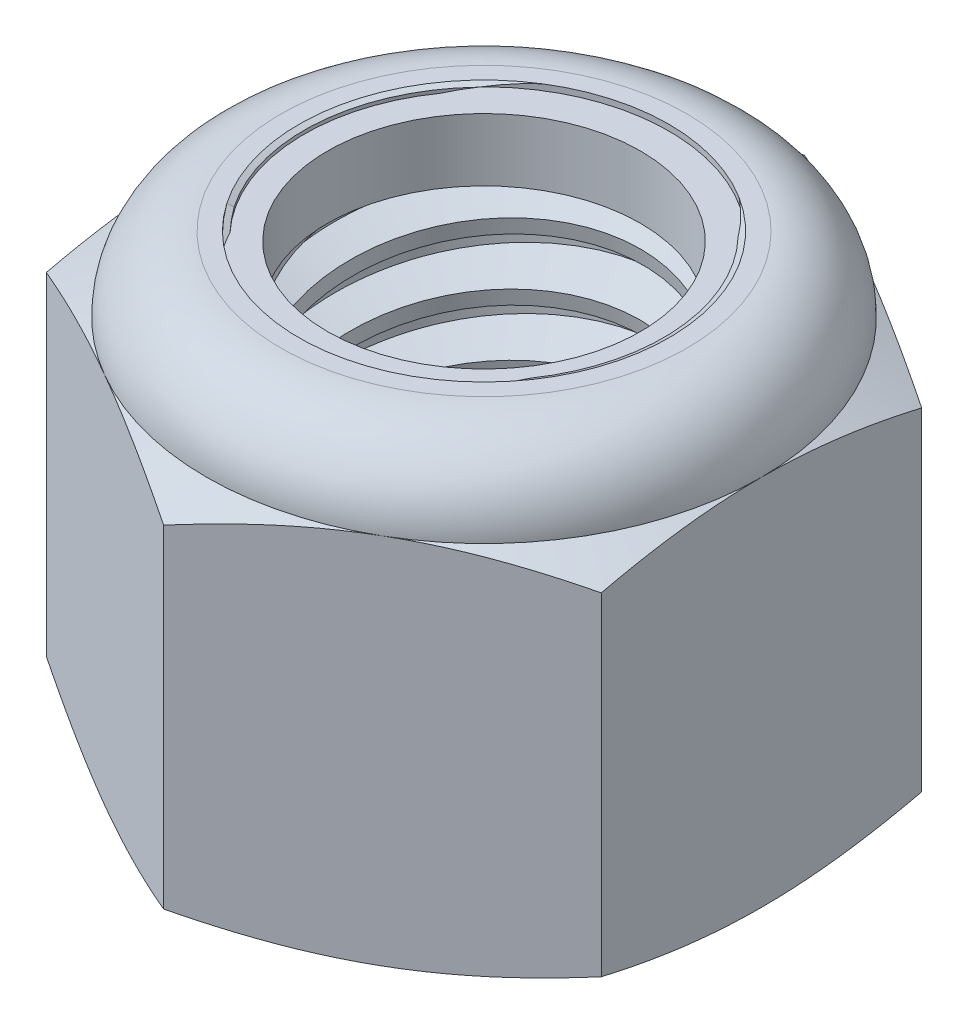
from build123d import *

# Parameters (mm, degrees)
EXTRUDE1_DEPTH       = 11.509375
SKETCH2_W            = 4.7625
SKETCH2_H            = 11.509375
LPATTERN1_COUNT      = 7
LPATTERN1_PITCH      = 1.5875
LPATTERN1_COUNT_DIR2 = 2
LPATTERN1_PITCH_DIR2 = 1.5875


with BuildPart() as part:
    # Sketch1 → Extrude1 (new body)
    with BuildSketch(Plane(origin=(0, 0, 0), x_dir=(1, 0, 0), z_dir=(0, 1, 0))):
        Polygon((0, 8.248891971), (-7.14375, 4.124445986), (-7.14375, -4.124445986), (0, -8.248891971), (7.14375, -4.124445986), (7.14375, 4.124445986), align=None)
    extrude(amount=EXTRUDE1_DEPTH)

    # Sketch4 → Cut-Revolve2 (revolve, cut)
    with BuildSketch(Plane(origin=(0, 0, 0), x_dir=(0, 0, -1), z_dir=(1, 0, 0))):
        Polygon((0, 11.509375), (4.7625, 11.509375), (4.029111805, 11.167390468), (4.029111805, 0.341984532), (4.7625, 0), (0, 0), align=None)
    revolve(axis=Axis((0, 11.509375, 0), (0, 1, 0)), mode=Mode.SUBTRACT)


with BuildPart() as body_2:
    # Sketch2 → Revolve1 (revolve)
    with BuildSketch(Plane(origin=(0, 0, 0), x_dir=(0, 0, -1), z_dir=(1, 0, 0))):
        with Locations((2.38125, 5.7546875)):
            Rectangle(SKETCH2_W, SKETCH2_H)
    revolve(axis=Axis((0, -4.7625, 0), (0, 1, 0)))

    # Sketch3 → Cut-Revolve1 (revolve, cut)
    with BuildSketch(Plane(origin=(0, 0, 0), x_dir=(0, 0, -1), z_dir=(1, 0, 0))):
        Polygon((4.795122924, 11.313637456), (5.023483392, 9.943474646), (4.094357653, 10.291557102), (4.029111805, 10.68303219), align=None)
    cut_revolve1 = revolve(axis=Axis((0, 11.509375, 0.28317269), (0, -0.9863939238321436, -0.16439898730535765)), mode=Mode.SUBTRACT)

    # LPattern1: Cut-Revolve1 7 × 2
    with Locations(*[Vector(0, -1, 0) * (i * LPATTERN1_PITCH) + Vector(0, 1, 0) * (j * LPATTERN1_PITCH_DIR2) for i in range(LPATTERN1_COUNT) for j in range(LPATTERN1_COUNT_DIR2) if (i, j) != (0, 0)]):
        add(cut_revolve1, mode=Mode.SUBTRACT)


with BuildPart() as part_1:
    add(part.part)

    # Combine1: cut body 2
    add(body_2.part, mode=Mode.SUBTRACT)

    # Sketch5 → Cut-Revolve3 (revolve, cut)
    with BuildSketch(Plane(origin=(0, 0, 0), x_dir=(0, 0, -1), z_dir=(1, 0, 0))):
        with BuildLine():
            Line((0, 0), (7.14375, 0))
            Line((7.14375, 0), (8.248891971, 0.515336164))
            Line((8.248891971, 0.515336164), (8.248891971, 9.075809669))
            Line((8.248891971, 9.075809669), (7.14375, 9.591145833))
            ThreePointArc((7.14375, 9.591145833), (6.581913685, 10.947538685), (5.225520833, 11.509375))
            Line((5.225520833, 11.509375), (5.225520833, 12.779375))
            Line((5.225520833, 12.779375), (9.518891971, 12.779375))
            Line((9.518891971, 12.779375), (9.518891971, -1.27))
            Line((9.518891971, -1.27), (0, -1.27))
            Line((0, -1.27), (0, 0))
        make_face()
    revolve(axis=Axis((0, 0, 0), (0, 1, 0)), mode=Mode.SUBTRACT)

    # Sketch6 → Cut-Revolve4 (revolve, cut)
    with BuildSketch(Plane(origin=(0, 0, 0), x_dir=(0, 0, -1), z_dir=(1, 0, 0))):
        with BuildLine():
            Line((0, 9.591145833), (6.99135, 9.591145833))
            ThreePointArc((6.99135, 9.591145833), (6.474150612, 10.839775612), (5.225520833, 11.356975))
            Line((5.225520833, 11.356975), (4.627316319, 11.356975))
            Line((4.627316319, 11.356975), (4.627316319, 12.779375))
            Line((4.627316319, 12.779375), (0, 12.779375))
            Line((0, 12.779375), (0, 9.591145833))
        make_face()
    revolve(axis=Axis((0, 12.779375, 0), (0, 1, 0)), mode=Mode.SUBTRACT)


with BuildPart() as body_2_2:
    # Sketch7 → Revolve2 (revolve)
    with BuildSketch(Plane(origin=(0, 0, 0), x_dir=(0, 0, -1), z_dir=(1, 0, 0))):
        with BuildLine():
            Line((4.029111805, 9.667345833), (6.913430867, 9.667345833))
            ThreePointArc((6.913430867, 9.667345833), (6.39301751, 10.812537757), (5.225520833, 11.280775))
            Line((5.225520833, 11.280775), (4.029111805, 11.280775))
            Line((4.029111805, 11.280775), (4.029111805, 9.667345833))
        make_face()
    revolve(axis=Axis((0, 9.667345833, 0), (0, 1, 0)))


solid = Compound([part_1.part, body_2_2.part])
